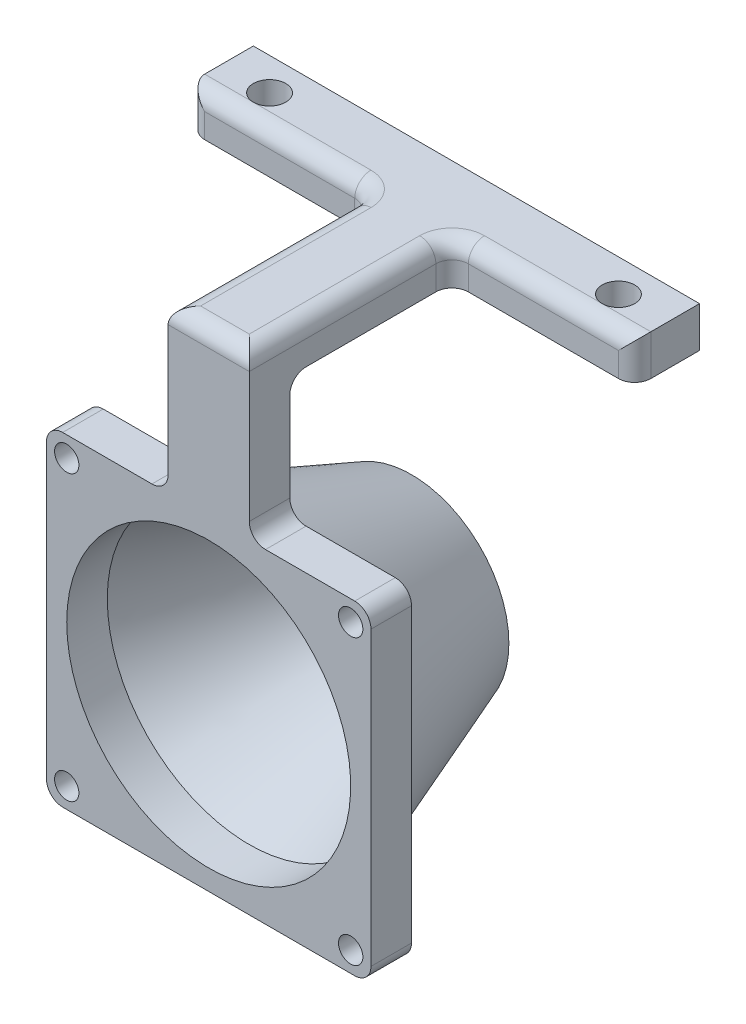
from build123d import *

# Parameters (mm, degrees)
ESQUISSE2_R             = 2
BOSS_EXTRU_1_DEPTH      = 5
ESQUISSE3_R             = 1.5
BOSS_EXTRU_2_DEPTH      = 5
ESQUISSE5_R             = 17.5
ENL_V_MAT_EXTRU_1_DEPTH = 68.566633777
ESQUISSE7_R             = 19.5
ESQUISSE8_R             = 12
CONG_2_R                = 2


with BuildPart() as part:
    # Esquisse2 → Boss.-Extru.1 (new body)
    with BuildSketch(Plane(origin=(0, 0, 0), x_dir=(1, 0, 0), z_dir=(0, 1, 0))):
        Polygon((5, -19.739092363), (27.5, -19.739092363), (27.5, -11.739092363), (-27.5, -11.739092363), (-27.5, -19.739092363), (-5, -19.739092363), (-5, -39.739092363), (5, -39.739092363), align=None)
        with Locations(Location((-21.5, -15.739092363, 0), (0, 0, 270))):
            Circle(ESQUISSE2_R, mode=Mode.SUBTRACT)
        with Locations(Location((21.5, -15.739092363, 0), (0, 0, 270))):
            Circle(ESQUISSE2_R, mode=Mode.SUBTRACT)
    extrude(amount=BOSS_EXTRU_1_DEPTH)

    # Esquisse3 → Boss.-Extru.2 (add)
    with BuildSketch(Plane.XY.offset(39.739092363)):
        Polygon((-5, 5), (5, 5), (5, -15), (20, -15), (20, -55), (-20, -55), (-20, -15), (-5, -15), align=None)
        with Locations((-17.5, -17.5)):
            Circle(ESQUISSE3_R, mode=Mode.SUBTRACT)
        with Locations((17.5, -17.5)):
            Circle(ESQUISSE3_R, mode=Mode.SUBTRACT)
        with Locations((17.5, -52.5)):
            Circle(ESQUISSE3_R, mode=Mode.SUBTRACT)
        with Locations((-17.5, -52.5)):
            Circle(ESQUISSE3_R, mode=Mode.SUBTRACT)
    extrude(amount=BOSS_EXTRU_2_DEPTH)

    # Esquisse5 → Enlèv. mat.-Extru.1 (cut, through all)
    with BuildSketch(Plane(origin=(0, 0, 39.739092363), x_dir=(-1, 0, 0), z_dir=(0, 0, -1))):
        with Locations((0, -35)):
            Circle(ESQUISSE5_R)
    extrude(amount=-ENL_V_MAT_EXTRU_1_DEPTH, mode=Mode.SUBTRACT)

    # Esquisse7 → Lissage3 section 0
    with BuildSketch(Plane(origin=(0, 0, 39.739092363), x_dir=(-1, 0, 0), z_dir=(0, 0, -1))):
        with Locations((0, -35)):
            Circle(ESQUISSE7_R)
    # Esquisse8 → Lissage3 section 1
    with BuildSketch(Plane(origin=(0, 0, 19.739092363), x_dir=(-1, 0, 0), z_dir=(0, 0, -1))):
        with Locations((0, -35)):
            Circle(ESQUISSE8_R)
    loft()

    # Enlèvement de matière-Lissage1: read off the stored shape, not the designer's step
    # Enlèvement de matière-Lissage1: loft between two sections, ruled curve by curve
    enl_vement_de_mati_re_lissage1_from = [
        Edge.make_bspline([(16.003401512, -27.918959112, 39.739092363), (30.165483288, -59.925762135, 39.739092363), (-1.841319736, -74.087843911, 39.739092363), (-16.003401512, -42.081040888, 39.739092363), (-30.165483288, -10.074237865, 39.739092363), (1.841319736, 4.087843911, 39.739092363), (16.003401512, -27.918959112, 39.739092363)], [0, 0, 0, 0, 0.5, 0.5, 0.5, 1, 1, 1, 1], 3, [1, 0.333333333, 0.333333333, 1, 0.333333333, 0.333333333, 1]),
    ]
    enl_vement_de_mati_re_lissage1_to = [
        Edge.make_bspline([(7.154976715, -28.013848827, 19.739092363), (21.127279061, -42.323802256, 19.739092363), (6.817325632, -56.296104602, 19.739092363), (-7.154976715, -41.986151173, 19.739092363), (-21.127279061, -27.676197744, 19.739092363), (-6.817325632, -13.703895398, 19.739092363), (7.154976715, -28.013848827, 19.739092363)], [0, 0, 0, 0, 0.5, 0.5, 0.5, 1, 1, 1, 1], 3, [1, 0.333333333, 0.333333333, 1, 0.333333333, 0.333333333, 1]),
    ]
    enl_vement_de_mati_re_lissage1 = Solid(Shell([*[Face.make_surface_from_curves(enl_vement_de_mati_re_lissage1_from[k], enl_vement_de_mati_re_lissage1_to[k]) for k in range(1)], Face(Wire(enl_vement_de_mati_re_lissage1_from)), Face(Wire(enl_vement_de_mati_re_lissage1_to))]))
    add(enl_vement_de_mati_re_lissage1, mode=Mode.SUBTRACT)

    # Congé2
    cong_2_edges = [part.edges().sort_by_distance(p)[0] for p in [
        (-20, -15, 42.239092363),
        (-20, -55, 42.239092363),
        (20, -55, 42.239092363),
        (20, -15, 42.239092363),
        (-5, 5, 32.239092363),
        (5, 5, 32.239092363),
        (5, -15, 42.239092363),
        (-5, -15, 42.239092363),
        (-16.25, 5, 19.739092363),
        (16.25, 5, 19.739092363),
        (0, 5, 44.739092363),
        (27.5, 2.5, 19.739092363),
        (-27.5, 2.5, 19.739092363),
        (-5, 2.5, 19.739092363),
        (5, 2.5, 19.739092363),
        (0, 0, 39.739092363),
    ]]
    fillet(cong_2_edges, radius=CONG_2_R - 0.0001)  # a hair under: the kernel refuses the full size


solid = part.part
